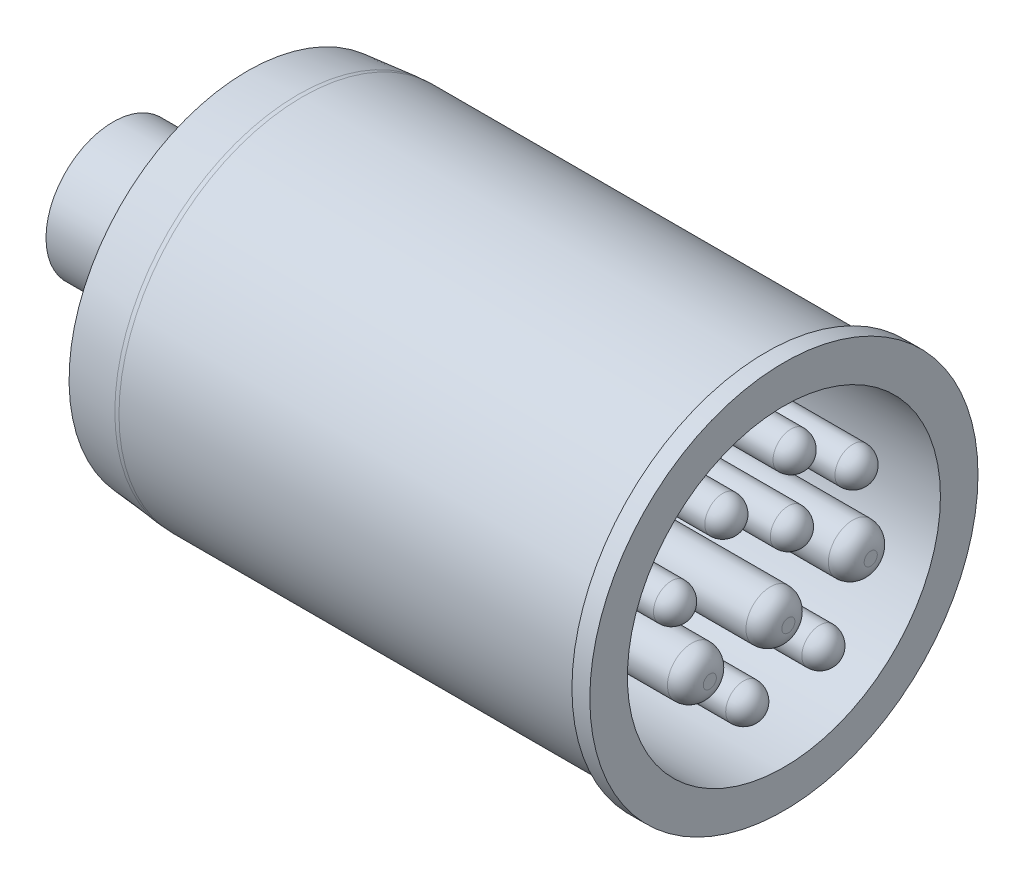
from build123d import *

# Parameters (mm, degrees)
FILLET1_R               = 5
FILLET2_R               = 0.3
FILLET3_R               = 5
SKETCH4_R               = 17.500000000000004
CUT_EXTRUDE1_DEPTH      = 35
SKETCH5_R               = 2.0006066698857174
SKETCH5_R_2             = 2.0006066698857157
SKETCH5_R_3             = 2.000606669885716
SKETCH5_R_4             = 2.733173099565215
BOSS_EXTRUDE1_DEPTH     = 35
FILLET4_R               = 2
BOSS_EXTRUDE2_START     = -2
SKETCH6_R               = 21.7
SKETCH6_R_2             = 20.5
BOSS_EXTRUDE2_DEPTH     = 2
SKETCH7_R               = 7.5
SKETCH7_R_2             = 7
EXTRUDE_THIN1_DEPTH     = 15
CUT_EXTRUDE2_DEPTH      = 74.00342484850054
CUT_EXTRUDE2_DEPTH_BACK = 74.00342484850054


with BuildPart() as part:
    # Sketch3 → Revolve1 (revolve)
    with BuildSketch(Plane.XY, mode=Mode.PRIVATE) as revolve1_sk:
        with BuildLine():
            Line((65, 0), (65, 20.5))
            Line((65, 20.5), (10.914728577346645, 20.499999999999993))
            Line((10.914728577346645, 20.499999999999993), (-6.999999999999965, 18.75))
            Line((-6.999999999999965, 18.75), (-21.999999999999996, 18.749999999999993))
            Line((-21.999999999999996, 18.749999999999993), (-21.999999999999996, 23.5))
            Line((-21.999999999999996, 23.5), (-27.690911978745813, 23.5))
            ThreePointArc((-27.690911978745813, 23.5), (-34.19859974015539, 21.368483523128404), (-38.18424319433221, 15.800000000000004))
            ThreePointArc((-38.18424319433221, 15.800000000000004), (-39.63356808676015, 13.775096900680587), (-41.99999999999999, 13.000000000000009))
            Line((-41.99999999999999, 13.000000000000009), (-45, 13.000000000000004))
            Line((-45, 13.000000000000004), (-45, 0))
            Line((-45, 0), (-41.99999999999999, 0))
            Line((-41.99999999999999, 0), (65, 0))
        make_face()
    revolve(revolve1_sk.sketch.rotate(Axis((0, 0, 0), (1, 0, 0)), 90), axis=Axis((0, 0, 0), (1, 0, 0)))

    # Fillet1
    # the kernel refuses this fillet: 5 mm, written as the material it adds along each edge
    with BuildSketch(Plane(origin=(-21.999999999999996, 0, 0), x_dir=(0, 1.1e-16, 1), z_dir=(0, 1, -1.1e-16))) as fillet1_piece_1:
        with BuildLine():
            CenterArc((23.75, 4.993746088859545), FILLET1_R, 180, 87.13401601740111)
            Line((23.5, 0), (23.495, -0.09987492177718948))
            ThreePointArc((23.495, -0.09987492177718948), (21.124999999999996, -0.10000000000000142), (18.749999999999993, -0.10000000000000142))
            Line((18.749999999999993, -0.10000000000000142), (18.64999999999999, 0))
            Line((18.64999999999999, 0), (18.65, 4.993746088859545))
            Line((18.65, 4.993746088859545), (18.75, 4.993746088859545))
        make_face()
    revolve(axis=Axis((-21.999999999999996, 0, 0), (1, 0, 0)))

    # Fillet2
    fillet2_edges = [part.edges().sort_by_distance(p)[0] for p in [
        (-21.999999999999996, 4.95e-15, -23.5),
    ]]
    fillet(fillet2_edges, radius=FILLET2_R)

    # Fillet3
    # the kernel refuses this fillet: 5 mm, written as the material it adds along each edge
    with BuildSketch(Plane(origin=(-6.999999999999965, 0, 0), x_dir=(0, 1.1e-16, 1), z_dir=(0, 1, -1.1e-16))) as fillet3_piece_1:
        with BuildLine():
            CenterArc((18.75 + FILLET3_R, -FILLET3_R * 0.0487265272305), FILLET3_R, 174.42076403235384, 5.579235967646127)
            Line((18.75 + FILLET3_R * 0.00473730125852, FILLET3_R * 0.0484956949917), (18.75, 0))
            Line((18.75, 0), (18.75, -FILLET3_R * 0.0487265272305))
        make_face()
    revolve(axis=Axis((-6.999999999999965, 0, 0), (1, 0, 0)))
    # the kernel refuses this fillet: 5 mm, written as the material it takes off along each edge
    with BuildSketch(Plane(origin=(10.914728577346645, 0, 0), x_dir=(0, 1.1e-16, 1), z_dir=(0, 1, -1.1e-16))) as fillet3_2_piece_1:
        with BuildLine():
            CenterArc((20.499999999999993 - FILLET3_R, FILLET3_R * 0.0487265272305), FILLET3_R, 354.4207640323539, 5.579235967646187)
            Line((20.499999999999993, FILLET3_R * 0.0487265272305), (20.499999999999993, 0))
            Line((20.499999999999993, 0), (20.499999999999993 - FILLET3_R * 0.00473730125852, -FILLET3_R * 0.0484956949917))
        make_face()
    revolve(axis=Axis((10.914728577346645, 0, 0), (1, 0, 0)), mode=Mode.SUBTRACT)

    # Sketch4 → Cut-Extrude1 (cut)
    with BuildSketch(Plane(origin=(65, 0, 0), x_dir=(0, 0, -1), z_dir=(1, 0, 0))):
        Circle(SKETCH4_R)
    extrude(amount=-CUT_EXTRUDE1_DEPTH, mode=Mode.SUBTRACT)

    # Sketch5 → Boss-Extrude1 (add)
    with BuildSketch(Plane(origin=(30, 0, 0), x_dir=(0, 0, -1), z_dir=(1, 0, 0))):
        with Locations(Location((2.4851998621818705, 3.5673165613128455, 0), (0, 0, 180))):
            Circle(SKETCH5_R)
        with Locations(Location((2.784475529300205, 10.869395236751556, 0), (0, 0, 180))):
            Circle(SKETCH5_R_2)
        with Locations(Location((-4.843943845783035, 8.444175204210639, 0), (0, 0, 180))):
            Circle(SKETCH5_R)
        with Locations(Location((-10.576282104516107, 2.8441216745252547, 0), (0, 0, 180))):
            Circle(SKETCH5_R_3)
        with Locations(Location((9.707376349462452, 5.930765352304601, 0), (0, 0, 180))):
            Circle(SKETCH5_R_3)
        with Locations(Location((-2.5069136326072483, -10.869395236751556, 0), (0, 0, 180))):
            Circle(SKETCH5_R)
        with Locations(Location((6.003403936127238, -9.722927585004939, 0), (0, 0, 180))):
            Circle(SKETCH5_R)
        with Locations(Location((9.707376349462452, -2.1386031196042588, 0), (0, 0, 180))):
            Circle(SKETCH5_R_4)
        with Locations(Location((0.49154022580697854, -3.990589326271869, 0), (0, 0, 180))):
            Circle(SKETCH5_R_4)
        with Locations(Location((-8.28334680102288, -5.048867158653359, 0), (0, 0, 180))):
            Circle(SKETCH5_R_4)
    extrude(amount=BOSS_EXTRUDE1_DEPTH)

    # Fillet4
    fillet4_edges = [part.edges().sort_by_distance(p)[0] for p in [
        (65, 3.567316561312845, -4.485806532067588),
        (65, 10.869395236751556, -4.78508219918592),
        (65, 8.444175204210639, 2.8433371758973176),
        (65, 2.844121674525254, 8.57567543463039),
        (65, 5.9307653523046, -11.707983019348168),
        (65, -10.869395236751556, 0.5063069627215309),
        (65, -9.722927585004939, -8.004010606012956),
        (65, -2.1386031196042583, -12.440549449027667),
        (65, -3.9905893262718686, -3.2247133253721936),
        (65, -5.0488671586533584, 5.550173701457664),
    ]]
    fillet(fillet4_edges, radius=FILLET4_R)

    # Sketch6 → Boss-Extrude2 (add)
    with BuildSketch(Plane(origin=(65, 0, 0), x_dir=(0, 0, -1), z_dir=(1, 0, 0)).offset(BOSS_EXTRUDE2_START)):
        Circle(SKETCH6_R)
        Circle(SKETCH6_R_2, mode=Mode.SUBTRACT)
    extrude(amount=BOSS_EXTRUDE2_DEPTH)

    # Sketch7 → Extrude-Thin1 (add)
    with BuildSketch(Plane.ZY.offset(45)):
        Circle(SKETCH7_R)
        Circle(SKETCH7_R_2, mode=Mode.SUBTRACT)
    extrude(amount=EXTRUDE_THIN1_DEPTH)

    # Sketch8 → Cut-Extrude2 (cut, two sides: drawn at the far end of the back side and taken through both)
    with BuildSketch(Plane.XY.offset(-CUT_EXTRUDE2_DEPTH_BACK)):
        Polygon((-45, 24.858102264322046), (5.000000000000004, 24.858102264322046), (5.0000000000000115, -25.141897735677954), (-45, -25.141897735677954), align=None)
    extrude(amount=CUT_EXTRUDE2_DEPTH + CUT_EXTRUDE2_DEPTH_BACK, mode=Mode.SUBTRACT)


with BuildPart() as cut_extrude2_piece_1:
    # of the separate pieces the step leaves, piece 1, a body of its own (cut_extrude2_pieces)
    add(part.part.solids().sort_by_distance((63, -10.869395237, 4.507520302))[0])


with BuildPart() as cut_extrude2_piece_2:
    # of the separate pieces the step leaves, piece 2, a body of its own (cut_extrude2_pieces)
    add(part.part.solids().sort_by_distance((-45, 0, 7.5))[0])


with BuildPart() as cut_extrude2_piece_1_1:
    # Body-Move/Copy1: moved
    add(cut_extrude2_piece_1.part.moved(Location((-50, 0, 0))))


solid = Compound([cut_extrude2_piece_2.part, cut_extrude2_piece_1_1.part])
